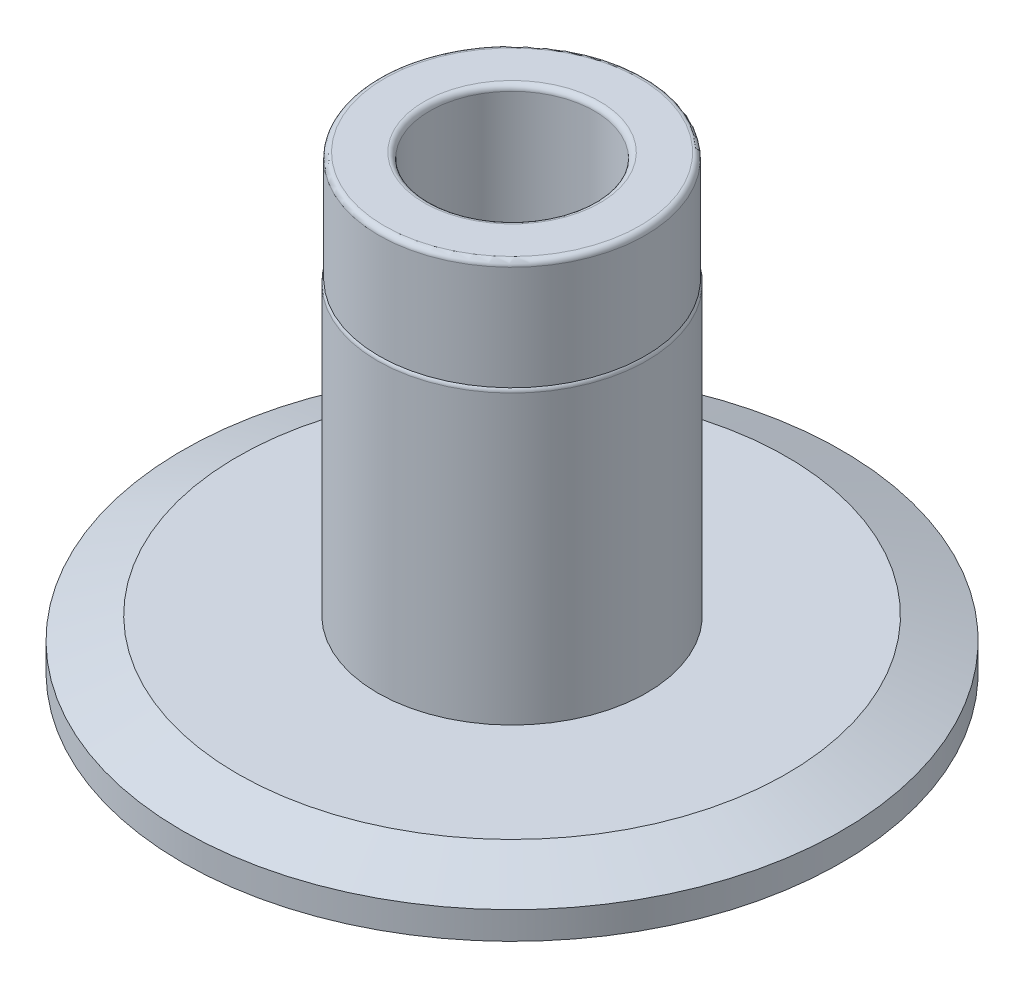
from build123d import *

# Parameters (mm, degrees)
SKETCH_1_R           = 6
SKETCH_1_R_2         = 1.5
EXTRUDE_1_DEPTH      = 0.9
EXTRUDE_2_DEPTH      = 7.3
EXTRUDE_2_DEPTH_BACK = 1.3
SKETCH_2_R           = 2.45
SKETCH_2_R_2         = 1.5
SKETCH_3_OUTSIDE_W   = 17.806
SKETCH_3_OUTSIDE_H   = 17.806
SKETCH_3_OUTSIDE_R   = 2.425
SKETCH_3_OUTSIDE_R_2 = 1.5
CUT_EXTRUDE_1_DEPTH  = 2
FILLET_1_R           = 0.1
FILLET_2_R           = 0.1
CHAMFER_1_SIZE       = 0.4
CHAMFER_1_SIZE2      = 1


with BuildPart() as part:
    # 草图1 → 凸台-拉伸1 (new body)
    with BuildSketch(Plane(origin=(0, 0, 0), x_dir=(1, 0, 0), z_dir=(0, 1, 0))):
        with Locations(Location((0, 0, 0), (0, 0, 270))):
            Circle(SKETCH_1_R)
        with Locations(Location((0, 0, 0), (0, 0, 270))):
            Circle(SKETCH_1_R_2, mode=Mode.SUBTRACT)
    extrude(amount=EXTRUDE_1_DEPTH)

    # 草图2 → 凸台-拉伸2 (add, two sides: drawn at the far end of the back side and taken through both)
    with BuildSketch(Plane(origin=(0, 0.9, 0), x_dir=(1, 0, 0), z_dir=(0, 1, 0)).offset(-EXTRUDE_2_DEPTH_BACK)):
        with Locations(Location((0, 0, 0), (0, 0, 270))):
            Circle(SKETCH_2_R)
        with Locations(Location((0, 0, 0), (0, 0, 270))):
            Circle(SKETCH_2_R_2, mode=Mode.SUBTRACT)
    extrude(amount=EXTRUDE_2_DEPTH + EXTRUDE_2_DEPTH_BACK)

    # 草图3 outside → 切除-拉伸1 (cut)
    # profile 1 of 2: a face of its own
    with BuildSketch(Plane(origin=(0, 8.2, 0), x_dir=(1, 0, 0), z_dir=(0, 1, 0))):
        Rectangle(SKETCH_3_OUTSIDE_W, SKETCH_3_OUTSIDE_H)
        with Locations(Location((0, 0, 0), (0, 0, 270))):
            Circle(SKETCH_3_OUTSIDE_R, mode=Mode.SUBTRACT)
    # profile 2 of 2: a face of its own
    with BuildSketch(Plane(origin=(0, 8.2, 0), x_dir=(1, 0, 0), z_dir=(0, 1, 0))):
        with Locations(Location((0, 0, 0), (0, 0, 270))):
            Circle(SKETCH_3_OUTSIDE_R_2)
    extrude(amount=-CUT_EXTRUDE_1_DEPTH, mode=Mode.SUBTRACT)

    # 圆角1
    fillet_1_edges = [part.edges().sort_by_distance(p)[0] for p in [
        (0, -0.4, -2.45),
        (0, -0.4, -1.5),
        (0, 8.2, -1.5),
        (0, 8.2, -2.425),
    ]]
    fillet(fillet_1_edges, radius=FILLET_1_R)

    # 圆角2
    # the kernel refuses this fillet: 0.1 mm, written as the material it takes off along each edge
    with BuildSketch(Plane(origin=(0, 6.2, 0), x_dir=(0, 0, 1), z_dir=(1, 0, 0))) as fillet_2_piece_1:
        with BuildLine():
            CenterArc((2.35, 0.066143783), FILLET_2_R, 318.590377891, 41.409622109)
            Line((2.425, 0), (2.4265, -0.001322876))
            ThreePointArc((2.4265, -0.001322876), (2.4375, -0.002), (2.45, -0.002))
            Line((2.45, -0.002), (2.452, 0))
            Line((2.452, 0), (2.452, 0.066143783))
            Line((2.452, 0.066143783), (2.45, 0.066143783))
        make_face()
    revolve(axis=Axis((0, 6.2, 0), (0, -1, 0)), mode=Mode.SUBTRACT)

    # 倒角1
    chamfer_1_edges = [part.edges().sort_by_distance(p)[0] for p in [
        (0, 0.9, -6),
    ]]
    chamfer_1_side = [part.faces().sort_by_distance(p)[0] for p in [
        (0, 0.45, -6),
    ]]
    chamfer(chamfer_1_edges, length=CHAMFER_1_SIZE, length2=CHAMFER_1_SIZE2, reference=chamfer_1_side[0])


solid = part.part
